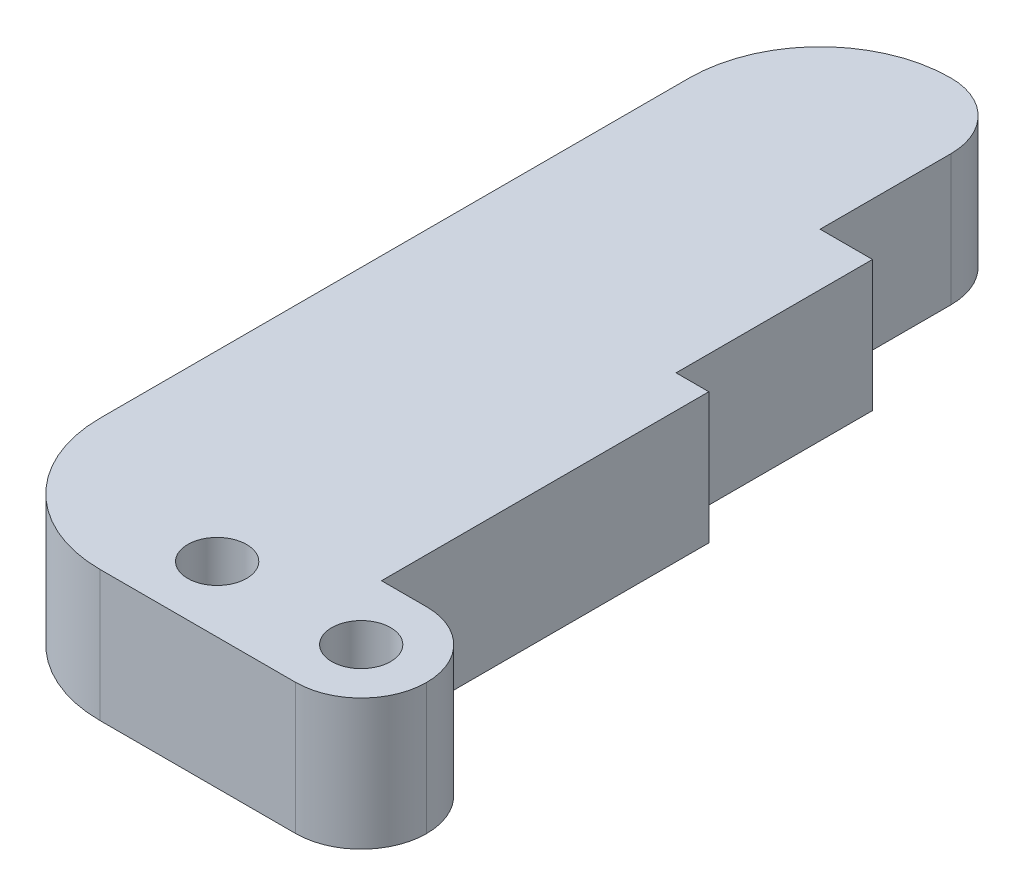
from build123d import *

# Parameters (mm, degrees)
BOSS_EXTRUDE1_DEPTH = 10
SKETCH3_R           = 2.25
CUT_EXTRUDE1_DEPTH  = 10
FILLET1_R           = 10
FILLET2_R           = 5


with BuildPart() as part:
    # Sketch2 → Boss-Extrude1 (new body)
    with BuildSketch(Plane(origin=(0, 0, 0), x_dir=(1, 0, 0), z_dir=(0, 1, 0))):
        Polygon((-8.45, 15), (-10.95, 15), (-10.95, 30), (-14.95, 30), (-14.95, 45), (-29.95, 45), (-29.95, -20), (0, -20), (0, -10), (-8.45, -10), align=None)
    extrude(amount=BOSS_EXTRUDE1_DEPTH)

    # Sketch3 → Cut-Extrude1 (cut)
    with BuildSketch(Plane(origin=(0, 10, 0), x_dir=(1, 0, 0), z_dir=(0, 1, 0))):
        with Locations(Location((-5, -15, 0), (0, 0, 270))):
            Circle(SKETCH3_R)
        with Locations(Location((-16, -15, 0), (0, 0, 270))):
            Circle(SKETCH3_R)
    extrude(amount=-CUT_EXTRUDE1_DEPTH, mode=Mode.SUBTRACT)

    # Fillet1
    fillet1_edges = [part.edges().sort_by_distance(p)[0] for p in [
        (-29.95, 5, 20),
        (-29.95, 5, -45),
    ]]
    fillet(fillet1_edges, radius=FILLET1_R)

    # Fillet2
    fillet2_edges = [part.edges().sort_by_distance(p)[0] for p in [
        (-14.95, 5, -45),
        (0, 5, 10),
        (0, 5, 20),
    ]]
    fillet(fillet2_edges, radius=FILLET2_R - 0.0001)  # a hair under: the kernel refuses the full size


solid = part.part
